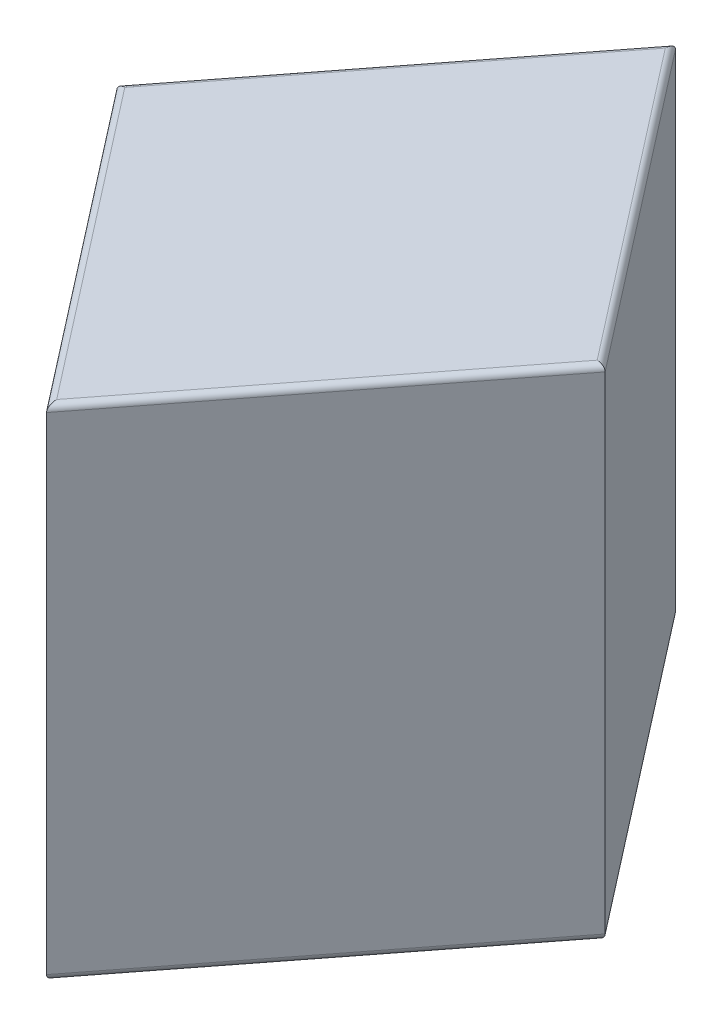
from build123d import *

# Parameters (mm, degrees)
BOSS_EXTRUDE1_DEPTH = 40
FILLET1_R           = 0.5


with BuildPart() as part:
    # Sketch1 → Boss-Extrude1 (new body)
    with BuildSketch(Plane(origin=(0, 0, 0), x_dir=(1, 0, 0), z_dir=(0, 1, 0))):
        Polygon((0, -25.2), (19.559396719, 0), (0, 25.2), (-19.559396719, 0), align=None)
    extrude(amount=BOSS_EXTRUDE1_DEPTH)

    # Fillet1
    fillet1_edges = [part.edges().sort_by_distance(p)[0] for p in [
        (9.779698359, 0, 12.6),
        (9.779698359, 0, -12.6),
        (-9.779698359, 0, -12.6),
        (-9.779698359, 0, 12.6),
        (-9.779698359, 40, -12.6),
        (9.779698359, 40, -12.6),
        (9.779698359, 40, 12.6),
        (-9.779698359, 40, 12.6),
    ]]
    fillet(fillet1_edges, radius=FILLET1_R)


solid = part.part
